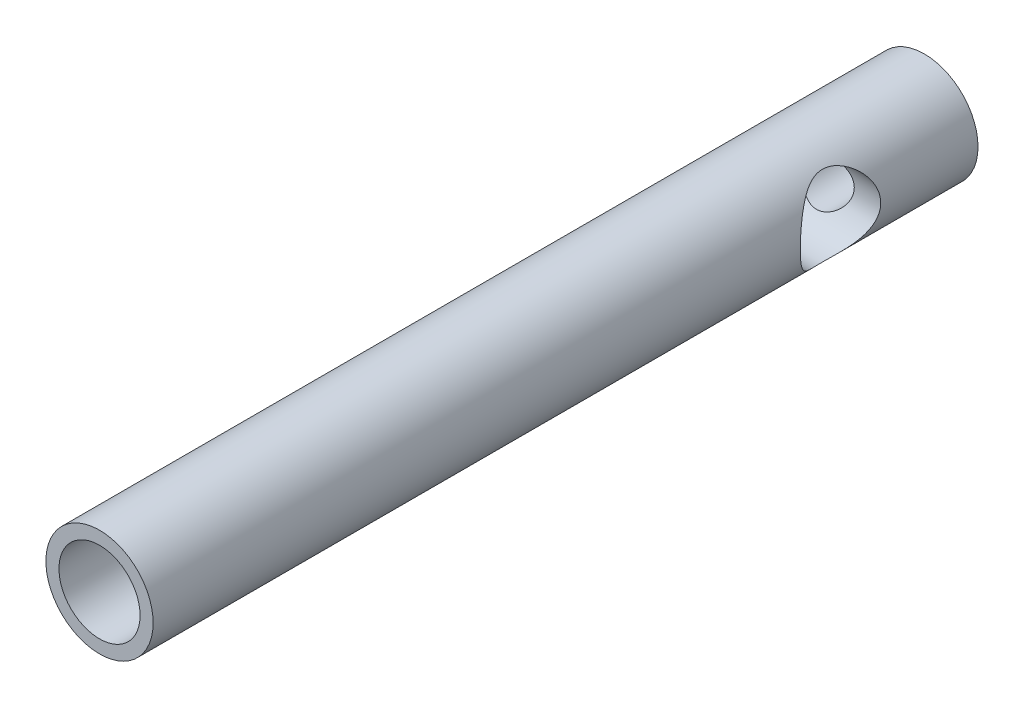
from build123d import *

# Parameters (mm, degrees)
CROQUIS1_R              = 3.9
SALIENTE_EXTRUIR1_DEPTH = 60
CROQUIS6_R              = 2.95
CORTAR_EXTRUIR2_DEPTH   = 15
CROQUIS9_R              = 1.975
CORTAR_EXTRUIR6_DEPTH   = 61.252966732
CROQUIS10_R             = 2.925
CORTAR_EXTRUIR7_DEPTH   = 5


with BuildPart() as part:
    # Croquis1 → Saliente-Extruir1 (new body)
    with BuildSketch(Plane.XY):
        Circle(CROQUIS1_R)
    extrude(amount=SALIENTE_EXTRUIR1_DEPTH)

    # Croquis6 → Cortar-Extruir2 (cut)
    with BuildSketch(Plane.XY.offset(60)):
        Circle(CROQUIS6_R)
    extrude(amount=-CORTAR_EXTRUIR2_DEPTH, mode=Mode.SUBTRACT)

    # Croquis9 → Cortar-Extruir6 (cut, through all)
    with BuildSketch(Plane(origin=(0, 0, 0), x_dir=(-1, 0, 0), z_dir=(0, 0, -1))):
        Circle(CROQUIS9_R)
    extrude(amount=-CORTAR_EXTRUIR6_DEPTH, mode=Mode.SUBTRACT)

    # Croquis10 → Cortar-Extruir7 (cut, symmetric)
    with BuildSketch(Plane(origin=(3.9, -3.9, 0), x_dir=(0, 1, 0), z_dir=(-1, 0, 0))):
        with Locations((3.9, -10)):
            Circle(CROQUIS10_R)
    extrude(amount=CORTAR_EXTRUIR7_DEPTH, both=True, mode=Mode.SUBTRACT)


solid = part.part
